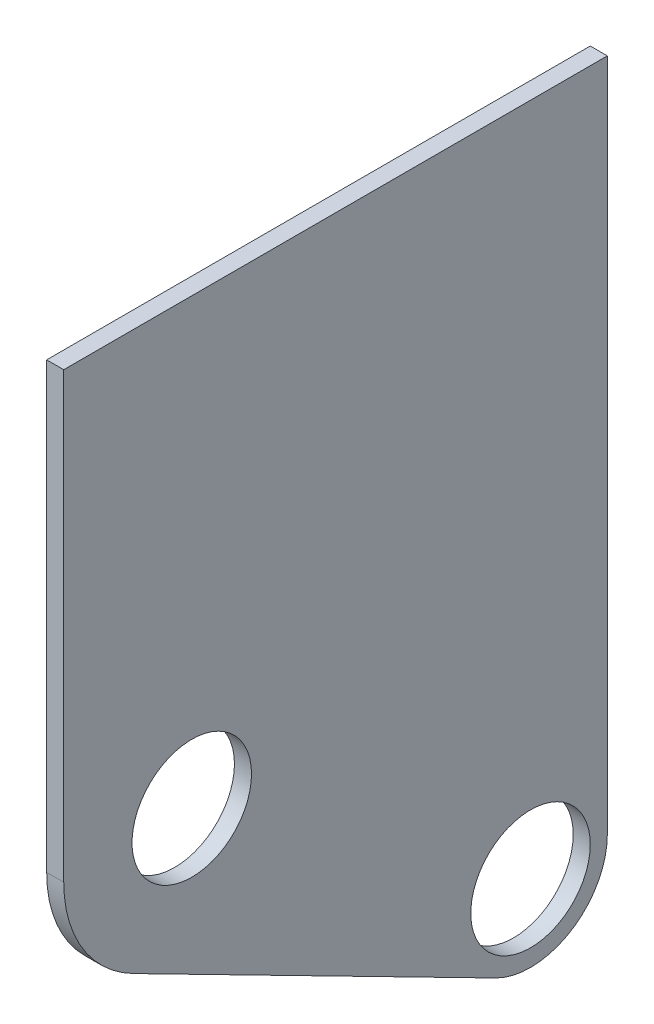
from build123d import *

# Parameters (mm, degrees)
SKETCH2_R           = 11.1125
BOSS_EXTRUDE1_DEPTH = 3.175


with BuildPart() as part:
    # Sketch2 → Boss-Extrude1 (new body)
    with BuildSketch(Plane(origin=(0, 0, 0), x_dir=(0, 0, -1), z_dir=(1, 0, 0))):
        with BuildLine():
            Line((50.550976547, 0), (-50.550976547, 0))
            Line((-50.550976547, 0), (-50.550976547, -82.55))
            ThreePointArc((-50.550976547, -82.55), (-47.047192366, -94.983471682), (-37.566937236, -103.758007813))
            Line((-37.566937236, -103.758007813), (29.766400134, -138.137304687))
            ThreePointArc((29.766400134, -138.137304687), (43.723559556, -137.597729491), (50.550976547, -125.4125))
            Line((50.550976547, -125.4125), (50.550976547, 0))
        make_face()
        with Locations((-26.738476547, -82.55)):
            Circle(SKETCH2_R, mode=Mode.SUBTRACT)
        with Locations((36.263476547, -125.4125)):
            Circle(SKETCH2_R, mode=Mode.SUBTRACT)
    extrude(amount=BOSS_EXTRUDE1_DEPTH)


solid = part.part
